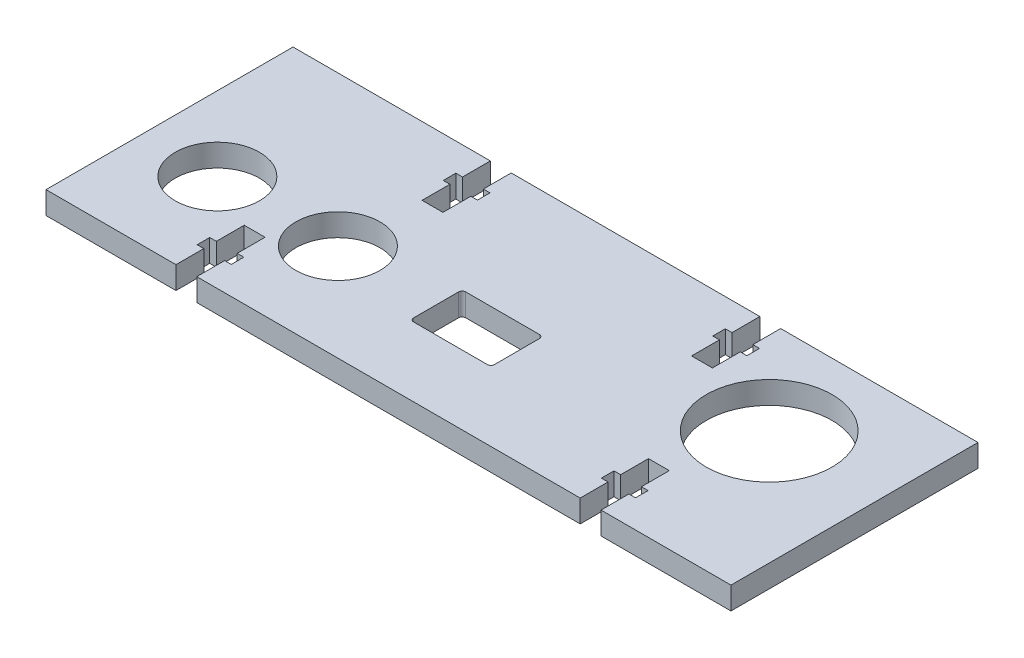
from build123d import *

# Parameters (mm, degrees)
SKETCH1_W                = 96.8375
SKETCH1_H                = 34.925
BOSS_EXTRUDE1_DEPTH      = 3.175
F_7_16_CLEARANCE_HOLE1_D = 11.90498
SKETCH6_W                = 11.43
SKETCH6_H                = 7.366
CUT_EXTRUDE1_DEPTH       = 52.56932114
CUT_EXTRUDE3_DEPTH       = 52.56932114
SKETCH9_R                = 8.89
CUT_EXTRUDE4_DEPTH       = 52.56932114
FILLET1_R                = 0.508


with BuildPart() as part:
    # Sketch1 → Boss-Extrude1 (new body)
    with BuildSketch(Plane(origin=(0, 0, 0), x_dir=(1, 0, 0), z_dir=(0, 1, 0))):
        Rectangle(SKETCH1_W, SKETCH1_H)
    extrude(amount=BOSS_EXTRUDE1_DEPTH)

    # 7/16 Clearance Hole1 (through all)
    with Locations(Plane(origin=(0, 3.175, 0), x_dir=(1, 0, 0), z_dir=(0, 1, 0))):
        with Locations((-37.9095, -3.7465), (-20.8661, -3.7465)):
            Hole(F_7_16_CLEARANCE_HOLE1_D / 2)

    # Sketch6 → Cut-Extrude1 (cut, through all)
    with BuildSketch(Plane(origin=(0, 3.175, 0), x_dir=(1, 0, 0), z_dir=(0, 1, 0))):
        with Locations((-1.016, -4.0005)):
            Rectangle(SKETCH6_W, SKETCH6_H)
    extrude(amount=-CUT_EXTRUDE1_DEPTH, mode=Mode.SUBTRACT)

    # Sketch8 → Cut-Extrude3 (cut, through all)
    with BuildSketch(Plane(origin=(0, 3.175, 0), x_dir=(1, 0, 0), z_dir=(0, 1, 0))):
        Polygon((27.1018, -17.4625), (30.0482, -17.4625), (30.0482, -13.5255), (30.988, -13.5255), (30.988, -11.7475), (30.0482, -11.7475), (30.0482, -7.8105), (27.1018, -7.8105), (27.1018, -11.7475), (26.162, -11.7475), (26.162, -13.5255), (27.1018, -13.5255), align=None)
        Polygon((-30.0482, -17.4625), (-27.1018, -17.4625), (-27.1018, -13.5255), (-26.162, -13.5255), (-26.162, -11.7475), (-27.1018, -11.7475), (-27.1018, -7.8105), (-30.0482, -7.8105), (-30.0482, -11.7475), (-30.988, -11.7475), (-30.988, -13.5255), (-30.0482, -13.5255), align=None)
        Polygon((17.5768, 11.7475), (17.5768, 7.8105), (20.5232, 7.8105), (20.5232, 11.7475), (21.463, 11.7475), (21.463, 13.5255), (20.5232, 13.5255), (20.5232, 17.4625), (17.5768, 17.4625), (17.5768, 13.5255), (16.637, 13.5255), (16.637, 11.7475), align=None)
        Polygon((-20.5232, 11.7475), (-20.5232, 7.8105), (-17.5768, 7.8105), (-17.5768, 11.7475), (-16.637, 11.7475), (-16.637, 13.5255), (-17.5768, 13.5255), (-17.5768, 17.4625), (-20.5232, 17.4625), (-20.5232, 13.5255), (-21.463, 13.5255), (-21.463, 11.7475), align=None)
    extrude(amount=-CUT_EXTRUDE3_DEPTH, mode=Mode.SUBTRACT)

    # Sketch9 → Cut-Extrude4 (cut, through all)
    with BuildSketch(Plane(origin=(0, 3.175, 0), x_dir=(1, 0, 0), z_dir=(0, 1, 0))):
        with Locations((32.2326, 4.1275)):
            Circle(SKETCH9_R)
    extrude(amount=-CUT_EXTRUDE4_DEPTH, mode=Mode.SUBTRACT)

    # Fillet1
    fillet1_edges = [part.edges().sort_by_distance(p)[0] for p in [
        (4.699, 1.5875, 0.3175),
        (-6.731, 1.5875, 0.3175),
        (-6.731, 1.5875, 7.6835),
        (4.699, 1.5875, 7.6835),
    ]]
    fillet(fillet1_edges, radius=FILLET1_R)


solid = part.part
